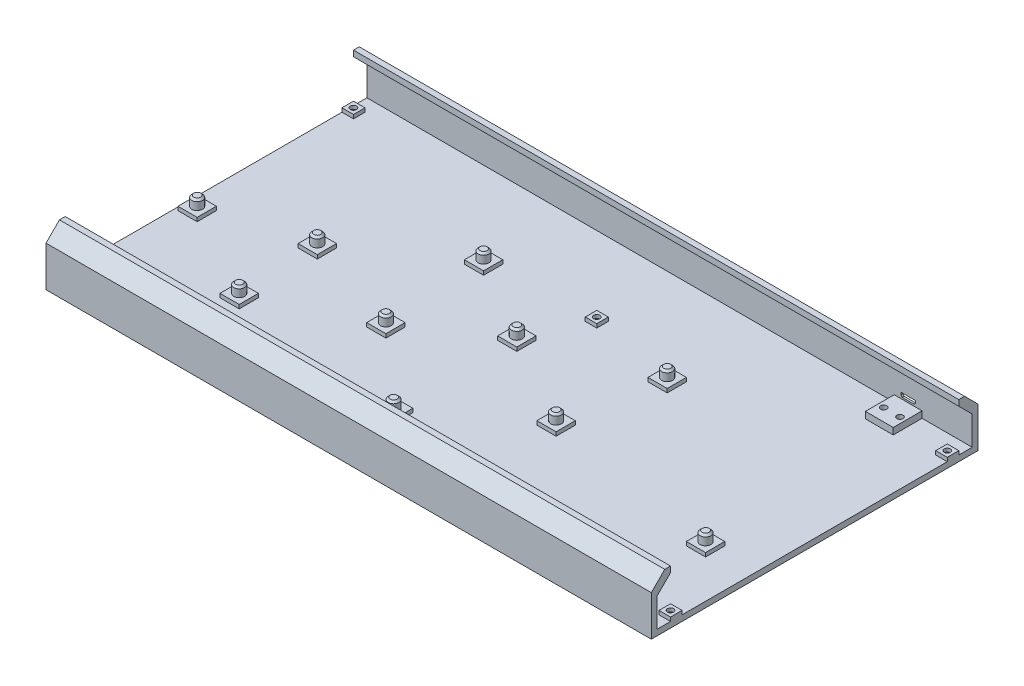
from build123d import *

# Parameters (mm, degrees)
SKETCH3_W           = 315
SKETCH3_H           = 170
BOSS_EXTRUDE1_DEPTH = 3
SKETCH5_W           = 6
SKETCH5_H           = 6
SKETCH5_W_2         = 10
SKETCH5_H_2         = 10
SKETCH5_W_3         = 10.000000001
BOSS_EXTRUDE2_DEPTH = 2
SKETCH6_R           = 2.65
CUT_EXTRUDE1_DEPTH  = 3.2
SKETCH7_R           = 1.6
CUT_EXTRUDE2_DEPTH  = 354.341194881
SKETCH8_R           = 2.8
BOSS_EXTRUDE3_DEPTH = 10
CHAMFER1_SIZE       = 1
SKETCH9_W           = 315
SKETCH9_H           = 3
BOSS_EXTRUDE4_DEPTH = 28
SKETCH10_W          = 315
SKETCH10_H          = 10
BOSS_EXTRUDE5_DEPTH = 3
CHAMFER2_SIZE       = 7
CUT_EXTRUDE3_DEPTH  = 22
SKETCH12_W          = 14.5
SKETCH12_H          = 3.389246664
BOSS_EXTRUDE6_DEPTH = 18
SKETCH13_R          = 1.6
CUT_EXTRUDE4_DEPTH  = 3.389246664
SKETCH14_W          = 14
SKETCH14_H          = 8
CUT_EXTRUDE5_DEPTH  = 2


with BuildPart() as part:
    # Sketch3 → Boss-Extrude1 (new body)
    with BuildSketch(Plane(origin=(0, 0, 0), x_dir=(1, 0, 0), z_dir=(0, 1, 0))):
        with Locations((157.5, 75)):
            Rectangle(SKETCH3_W, SKETCH3_H)
    extrude(amount=BOSS_EXTRUDE1_DEPTH)

    # Sketch5 → Boss-Extrude2 (add)
    with BuildSketch(Plane(origin=(0, 3, 0), x_dir=(1, 0, 0), z_dir=(0, 1, 0))):
        with Locations((3, 147)):
            Rectangle(SKETCH5_W, SKETCH5_H)
        with Locations((3, 3)):
            Rectangle(SKETCH5_W, SKETCH5_H)
        with Locations((6.687473524, 61.969040414)):
            Rectangle(SKETCH5_W_2, SKETCH5_H_2)
        with Locations((54.760126517, 76.409830141)):
            Rectangle(SKETCH5_W_3, SKETCH5_H_2)
        with Locations((56.888706053, 33.647880775)):
            Rectangle(SKETCH5_W_2, SKETCH5_H_2)
        with Locations((105.328256476, 112.374037416)):
            Rectangle(SKETCH5_W_2, SKETCH5_H_2)
        with Locations((108.244116471, 58.640246108)):
            Rectangle(SKETCH5_W_2, SKETCH5_H_2)
        with Locations((148.295993654, 86.70517668)):
            Rectangle(SKETCH5_W_2, SKETCH5_H_2)
        with Locations((148.852724672, 22.047319758)):
            Rectangle(SKETCH5_W_2, SKETCH5_H_2)
        with Locations((149.108148483, 8.440789408)):
            Rectangle(SKETCH5_W, SKETCH5_H)
        with Locations((196.731592235, 58.70008969)):
            Rectangle(SKETCH5_W_2, SKETCH5_H_2)
        with Locations((206.112878642, 107.13858398)):
            Rectangle(SKETCH5_W_2, SKETCH5_H_2)
        with Locations((160.584813344, 116.030051039)):
            Rectangle(SKETCH5_W, SKETCH5_H)
        with Locations((260.487872979, 11.781843085)):
            Rectangle(SKETCH5_W_2, SKETCH5_H_2)
        with Locations((290.058812632, 43.173516523)):
            Rectangle(SKETCH5_W_3, SKETCH5_H_2)
        with Locations((312, 147)):
            Rectangle(SKETCH5_W, SKETCH5_H)
        with Locations((312, 3)):
            Rectangle(SKETCH5_W, SKETCH5_H)
    extrude(amount=BOSS_EXTRUDE2_DEPTH)

    # Sketch6 → Cut-Extrude1 (cut)
    with BuildSketch(Plane(origin=(0, 0, 0), x_dir=(1, 0, 0), z_dir=(0, 1, 0))):
        with Locations(Location((3, 147, 0), (0, 0, 270))):
            Circle(SKETCH6_R)
        with Locations(Location((3, 3, 0), (0, 0, 270))):
            Circle(SKETCH6_R)
        with Locations(Location((149.108148483, 8.440789408, 0), (0, 0, 270))):
            Circle(SKETCH6_R)
        with Locations(Location((160.584813344, 116.030051039, 0), (0, 0, 270))):
            Circle(SKETCH6_R)
        with Locations(Location((312, 3, 0), (0, 0, 270))):
            Circle(SKETCH6_R)
        with Locations(Location((312, 147, 0), (0, 0, 270))):
            Circle(SKETCH6_R)
    extrude(amount=CUT_EXTRUDE1_DEPTH, mode=Mode.SUBTRACT)

    # Sketch7 → Cut-Extrude2 (cut, through all)
    with BuildSketch(Plane(origin=(0, 0, 0), x_dir=(1, 0, 0), z_dir=(0, 1, 0))):
        with Locations(Location((3, 147, 0), (0, 0, 270))):
            Circle(SKETCH7_R)
        with Locations(Location((312, 147, 0), (0, 0, 270))):
            Circle(SKETCH7_R)
        with Locations(Location((312, 3, 0), (0, 0, 270))):
            Circle(SKETCH7_R)
        with Locations(Location((149.108148483, 8.440789408, 0), (0, 0, 270))):
            Circle(SKETCH7_R)
        with Locations(Location((160.584813344, 116.030051039, 0), (0, 0, 270))):
            Circle(SKETCH7_R)
        with Locations(Location((3, 3, 0), (0, 0, 270))):
            Circle(SKETCH7_R)
    extrude(amount=CUT_EXTRUDE2_DEPTH, mode=Mode.SUBTRACT)

    # Sketch8 → Boss-Extrude3 (add)
    with BuildSketch(Plane(origin=(0, 0, 0), x_dir=(1, 0, 0), z_dir=(0, 1, 0))):
        with Locations(Location((6.687473524, 61.969040414, 0), (0, 0, 270))):
            Circle(SKETCH8_R)
        with Locations(Location((54.760126516, 76.409830141, 0), (0, 0, 270))):
            Circle(SKETCH8_R)
        with Locations(Location((56.888706053, 33.647880775, 0), (0, 0, 270))):
            Circle(SKETCH8_R)
        with Locations(Location((108.244116471, 58.640246108, 0), (0, 0, 270))):
            Circle(SKETCH8_R)
        with Locations(Location((105.328256476, 112.374037416, 0), (0, 0, 270))):
            Circle(SKETCH8_R)
        with Locations(Location((148.295993654, 86.70517668, 0), (0, 0, 270))):
            Circle(SKETCH8_R)
        with Locations(Location((206.112878642, 107.13858398, 0), (0, 0, 270))):
            Circle(SKETCH8_R)
        with Locations(Location((196.731592235, 58.70008969, 0), (0, 0, 270))):
            Circle(SKETCH8_R)
        with Locations(Location((148.852724672, 22.047319758, 0), (0, 0, 270))):
            Circle(SKETCH8_R)
        with Locations(Location((260.487872979, 11.781843085, 0), (0, 0, 270))):
            Circle(SKETCH8_R)
        with Locations(Location((290.058812632, 43.173516523, 0), (0, 0, 270))):
            Circle(SKETCH8_R)
    extrude(amount=BOSS_EXTRUDE3_DEPTH)

    # Chamfer1
    chamfer1_edges = [part.edges().sort_by_distance(p)[0] for p in [
        (6.687473524, 10, -64.769040414),
        (54.760126516, 10, -79.209830141),
        (56.888706053, 10, -36.447880775),
        (108.244116471, 10, -61.440246108),
        (105.328256476, 10, -115.174037416),
        (148.295993654, 10, -89.50517668),
        (206.112878642, 10, -109.93858398),
        (196.731592235, 10, -61.50008969),
        (148.852724672, 10, -24.847319758),
        (260.487872979, 10, -14.581843085),
        (290.058812632, 10, -45.973516523),
    ]]
    chamfer(chamfer1_edges, length=CHAMFER1_SIZE)

    # Sketch9 → Boss-Extrude4 (add)
    with BuildSketch(Plane(origin=(0, 0, 0), x_dir=(1, 0, 0), z_dir=(0, 1, 0))):
        with Locations((157.5, 158.5)):
            Rectangle(SKETCH9_W, SKETCH9_H)
        with Locations((157.5, -8.5)):
            Rectangle(SKETCH9_W, SKETCH9_H)
    extrude(amount=BOSS_EXTRUDE4_DEPTH)

    # Sketch10 → Boss-Extrude5 (add)
    with BuildSketch(Plane(origin=(0, 28, 0), x_dir=(1, 0, 0), z_dir=(0, 1, 0))):
        with Locations((157.5, 155)):
            Rectangle(SKETCH10_W, SKETCH10_H)
        with Locations((157.5, -5)):
            Rectangle(SKETCH10_W, SKETCH10_H)
    extrude(amount=-BOSS_EXTRUDE5_DEPTH)

    # Chamfer2
    chamfer2_edges = [part.edges().sort_by_distance(p)[0] for p in [
        (157.5, 25, 7),
        (157.5, 25, -157),
    ]]
    chamfer(chamfer2_edges, length=CHAMFER2_SIZE - 0.0001)  # a hair under: the kernel refuses the full size
    chamfer2_2_edges = [part.edges().sort_by_distance(p)[0] for p in [
        (157.5, 28, 10),
        (157.5, 28, -160),
    ]]
    chamfer(chamfer2_2_edges, length=CHAMFER2_SIZE)

    # Sketch11 → Cut-Extrude3 (cut)
    with BuildSketch(Plane(origin=(0, 0, -160), x_dir=(-1, 0, 0), z_dir=(0, 0, -1))):
        Polygon((-277.845030897, 9.289246664), (-285.445030897, 9.289246664), (-285.445030897, 7.989246664), (-284.745030897, 7.289246664), (-278.545030897, 7.289246664), (-277.845030897, 7.989246664), align=None)
    extrude(amount=-CUT_EXTRUDE3_DEPTH, mode=Mode.SUBTRACT)

    # Sketch12 → Boss-Extrude6 (add)
    with BuildSketch(Plane(origin=(0, 0, -160), x_dir=(-1, 0, 0), z_dir=(0, 0, -1))):
        with Locations((-281.645030897, 4.694623332)):
            Rectangle(SKETCH12_W, SKETCH12_H)
    extrude(amount=-BOSS_EXTRUDE6_DEPTH)

    # Sketch13 → Cut-Extrude4 (cut)
    with BuildSketch(Plane(origin=(0, 6.389246664, 0), x_dir=(1, 0, 0), z_dir=(0, 1, 0))):
        with Locations(Location((277.395030897, 148.487326261, 0), (0, 0, 180))):
            Circle(SKETCH13_R)
        with Locations(Location((285.895030897, 148.487326261, 0), (0, 0, 180))):
            Circle(SKETCH13_R)
    extrude(amount=-CUT_EXTRUDE4_DEPTH, mode=Mode.SUBTRACT)

    # Sketch14 → Cut-Extrude5 (cut)
    with BuildSketch(Plane(origin=(0, 0, -160), x_dir=(-1, 0, 0), z_dir=(0, 0, -1))):
        with Locations((-281.645030897, 8.289246664)):
            Rectangle(SKETCH14_W, SKETCH14_H)
    extrude(amount=-CUT_EXTRUDE5_DEPTH, mode=Mode.SUBTRACT)


solid = part.part
